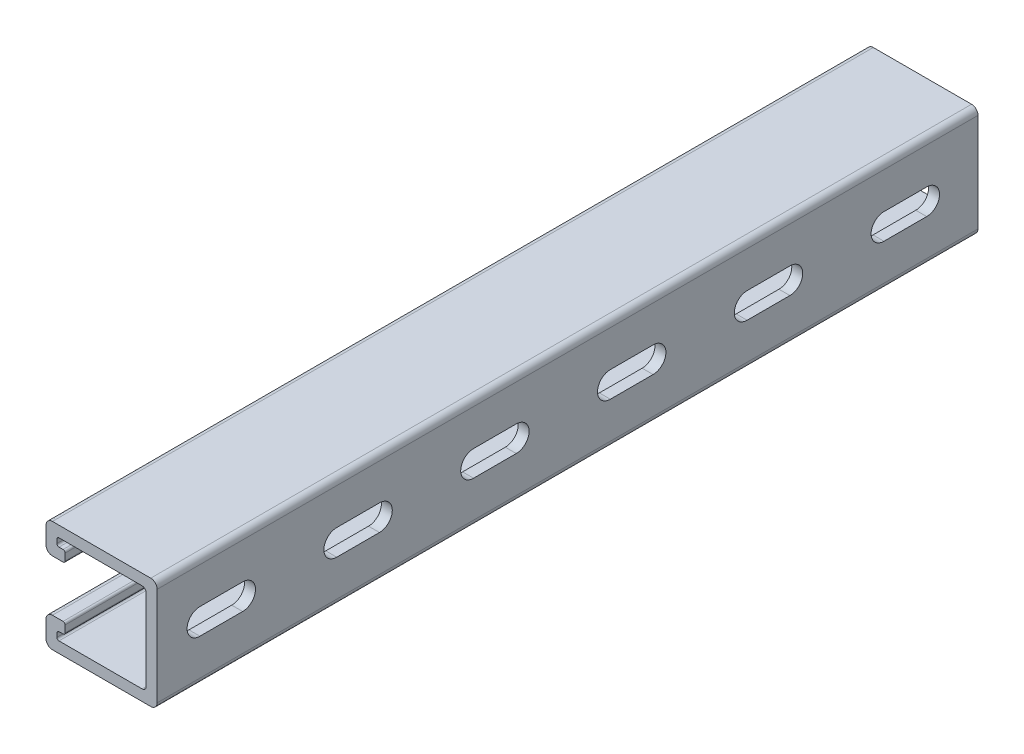
from build123d import *

# Parameters (mm, degrees)
EXTRUDE_THIN1_DEPTH = 304.8
FILLET2_R           = 0.762
FILLET3_R           = 1.524
CUT_EXTRUDE1_DEPTH  = 309.273534432
LPATTERN1_COUNT     = 6
LPATTERN1_PITCH     = 50.8


with BuildPart() as part:
    # Sketch1 → Extrude-Thin1 (new body)
    with BuildSketch(Plane.XY):
        with BuildLine():
            Line((-13.5255, 9.525), (-18.2499, 9.525))
            ThreePointArc((-18.2499, 9.525), (-19.938188151, 10.224311849), (-20.6375, 11.9126))
            Line((-20.6375, 11.9126), (-20.6375, 18.2499))
            ThreePointArc((-20.6375, 18.2499), (-19.938188151, 19.938188151), (-18.2499, 20.6375))
            Line((-18.2499, 20.6375), (18.2499, 20.6375))
            ThreePointArc((18.2499, 20.6375), (19.938188151, 19.938188151), (20.6375, 18.2499))
            Line((20.6375, 18.2499), (20.6375, -18.2499))
            ThreePointArc((20.6375, -18.2499), (19.938188151, -19.938188151), (18.2499, -20.6375))
            Line((18.2499, -20.6375), (-18.2499, -20.6375))
            ThreePointArc((-18.2499, -20.6375), (-19.938188151, -19.938188151), (-20.6375, -18.2499))
            Line((-20.6375, -18.2499), (-20.6375, -11.9126))
            ThreePointArc((-20.6375, -11.9126), (-19.938188151, -10.224311849), (-18.2499, -9.525))
            Line((-18.2499, -9.525), (-13.5255, -9.525))
            Line((-13.5255, -9.525), (-13.5255, -13.589))
            Line((-13.5255, -13.589), (-16.5735, -13.589))
            Line((-16.5735, -13.589), (-16.5735, -16.5735))
            Line((-16.5735, -16.5735), (16.5735, -16.5735))
            Line((16.5735, -16.5735), (16.5735, 16.5735))
            Line((16.5735, 16.5735), (-16.5735, 16.5735))
            Line((-16.5735, 16.5735), (-16.5735, 13.589))
            Line((-16.5735, 13.589), (-13.5255, 13.589))
            Line((-13.5255, 13.589), (-13.5255, 9.525))
        make_face()
    extrude(amount=-EXTRUDE_THIN1_DEPTH)

    # Fillet2
    fillet2_edges = [part.edges().sort_by_distance(p)[0] for p in [
        (-16.5735, 13.589, -152.4),
        (-16.5735, -16.5735, -152.4),
        (-16.5735, 16.5735, -152.4),
        (-13.5255, 13.589, -152.4),
        (-13.5255, 9.525, -152.4),
        (-13.5255, -9.525, -152.4),
        (-13.5255, -13.589, -152.4),
        (-16.5735, -13.589, -152.4),
    ]]
    fillet(fillet2_edges, radius=FILLET2_R)

    # Fillet3
    fillet3_edges = [part.edges().sort_by_distance(p)[0] for p in [
        (16.5735, 16.5735, -152.4),
        (16.5735, -16.5735, -152.4),
    ]]
    fillet(fillet3_edges, radius=FILLET3_R)

    # Sketch2 → Cut-Extrude1 (cut, through all)
    with BuildSketch(Plane(origin=(20.6375, 0, 0), x_dir=(0, 0, -1), z_dir=(1, 0, 0))):
        with BuildLine():
            Line((15.875, 4.7625), (31.75, 4.7625))
            ThreePointArc((31.75, 4.7625), (36.5125, 0), (31.75, -4.7625))
            Line((31.75, -4.7625), (15.875, -4.7625))
            ThreePointArc((15.875, -4.7625), (11.1125, 0), (15.875, 4.7625))
        make_face()
    cut_extrude1 = extrude(amount=-CUT_EXTRUDE1_DEPTH, mode=Mode.SUBTRACT)

    # LPattern1: Cut-Extrude1 ×6
    with Locations(*[(0, 0, -i * LPATTERN1_PITCH) for i in range(1, LPATTERN1_COUNT)]):
        add(cut_extrude1, mode=Mode.SUBTRACT)


solid = part.part
